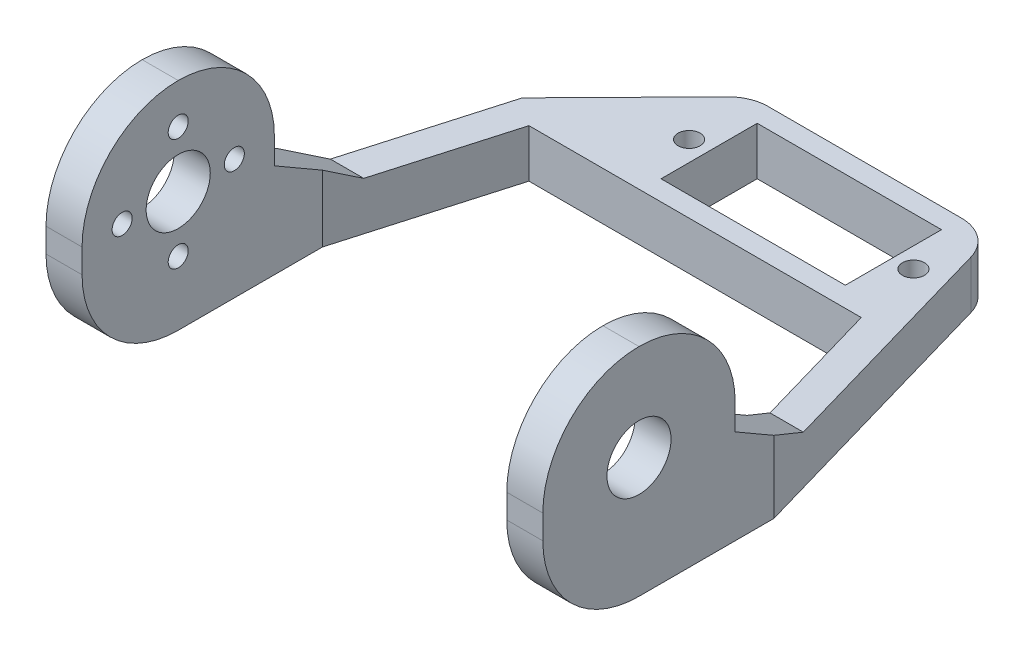
from build123d import *

# Parameters (mm, degrees)
BOSS_EXTRUDE1_DEPTH      = 3
BOSS_EXTRUDE1_DEPTH_BACK = 3
SKETCH1_R                = 1.375
SKETCH1_W                = 23
SKETCH1_H                = 12
SKETCH2_W                = 4.5
SKETCH2_H                = 24
BOSS_EXTRUDE2_DEPTH      = 21
CUT_EXTRUDE3_START       = -4.5
CUT_EXTRUDE3_OUTLINE_R   = 1.25
CUT_EXTRUDE3_DEPTH       = 4.5
CUT_EXTRUDE4_DEPTH       = 82.155714525
CUT_EXTRUDE4_DEPTH_BACK  = 82.155714525
SKETCH8_R                = 4
FILLET1_R                = 12
CHAMFER2_SIZE            = 10
CHAMFER2_SIZE2           = 5.773502692
CHAMFER3_SIZE            = 15
CHAMFER3_SIZE2           = 10
FILLET2_R                = 5


# Read off the part's stored shape, not the designer's step: Cut-Extrude3
with BuildPart() as part:
    # Sketch1 → Boss-Extrude1 (new, two sides: drawn at the far end of the back side and taken through both)
    with BuildSketch(Plane(origin=(0, 0, 0), x_dir=(1, 0, 0), z_dir=(0, 1, 0)).offset(-BOSS_EXTRUDE1_DEPTH_BACK)):
        Polygon((-31, 13.829866561), (-31, -15), (-26.5, -15), (-26.5, 15), (-20.736331389, 35), (20.736331389, 35), (26.5, 15), (26.5, -15), (31, -15), (31, 13.829866561), (20, 52), (-20, 52), align=None)
        with Locations(Location((18.75, 43.5, 0), (0, 0, 270))):
            Circle(SKETCH1_R, mode=Mode.SUBTRACT)
        with Locations(Location((-9.25, 43.5, 0), (0, 0, 270))):
            Circle(SKETCH1_R, mode=Mode.SUBTRACT)
        with Locations((4.75, 43.5)):
            Rectangle(SKETCH1_W, SKETCH1_H, mode=Mode.SUBTRACT)
    extrude(amount=BOSS_EXTRUDE1_DEPTH + BOSS_EXTRUDE1_DEPTH_BACK)

    # Sketch2 → Boss-Extrude2 (add)
    with BuildSketch(Plane(origin=(0, 3, 0), x_dir=(1, 0, 0), z_dir=(0, 1, 0))):
        with Locations((-28.75, -3)):
            Rectangle(SKETCH2_W, SKETCH2_H)
        with Locations((28.75, -3)):
            Rectangle(SKETCH2_W, SKETCH2_H)
    extrude(amount=BOSS_EXTRUDE2_DEPTH)

    # Cut-Extrude3 outline → Cut-Extrude3 (cut)
    with BuildSketch(Plane(origin=(-26.5, 0, 0), x_dir=(0, 0, -1), z_dir=(1, 0, 0)).offset(CUT_EXTRUDE3_START)):
        with Locations((-3, 19)):
            Circle(CUT_EXTRUDE3_OUTLINE_R)
        with Locations((4, 12)):
            Circle(CUT_EXTRUDE3_OUTLINE_R)
        with Locations((-3, 5)):
            Circle(CUT_EXTRUDE3_OUTLINE_R)
        with Locations((-10, 12)):
            Circle(CUT_EXTRUDE3_OUTLINE_R)
    extrude(amount=CUT_EXTRUDE3_DEPTH, mode=Mode.SUBTRACT)

    # Sketch8 → Cut-Extrude4 (cut, two sides: drawn at the far end of the back side and taken through both)
    with BuildSketch(Plane(origin=(-26.5, 0, 0), x_dir=(0, 0, -1), z_dir=(1, 0, 0)).offset(-CUT_EXTRUDE4_DEPTH_BACK)):
        with Locations((-3, 12)):
            Circle(SKETCH8_R)
    extrude(amount=CUT_EXTRUDE4_DEPTH + CUT_EXTRUDE4_DEPTH_BACK, mode=Mode.SUBTRACT)

    # Fillet1
    fillet1_edges = [part.edges().sort_by_distance(p)[0] for p in [
        (28.75, -3, 15),
        (-28.75, -3, 15),
        (-28.75, 24, -9),
        (28.75, 24, -9),
        (28.75, 24, 15),
        (-28.75, 24, 15),
    ]]
    fillet(fillet1_edges, radius=FILLET1_R - 0.0001)  # a hair under: the kernel refuses the full size

    # Chamfer2
    chamfer2_edges = [part.edges().sort_by_distance(p)[0] for p in [
        (-28.75, 3, -9),
        (28.75, 3, -9),
    ]]
    chamfer2_side = [part.faces().sort_by_distance(p)[0] for p in [
        (-1.966040558, 3, -36.302482854),
    ]]
    chamfer(chamfer2_edges, length=CHAMFER2_SIZE, length2=CHAMFER2_SIZE2, reference=chamfer2_side[0])

    # Chamfer3
    chamfer3_edges = [part.edges().sort_by_distance(p)[0] for p in [
        (-20, 0, -52),
    ]]
    chamfer3_side = [part.faces().sort_by_distance(p)[0] for p in [
        (-25.663082519, 0.130215421, -32.349034961),
    ]]
    chamfer(chamfer3_edges, length=CHAMFER3_SIZE, length2=CHAMFER3_SIZE2, reference=chamfer3_side[0])

    # Fillet2
    fillet2_edges = [part.edges().sort_by_distance(p)[0] for p in [
        (20, 0, -52),
        (-10, 0, -52),
    ]]
    fillet(fillet2_edges, radius=FILLET2_R)


solid = part.part
